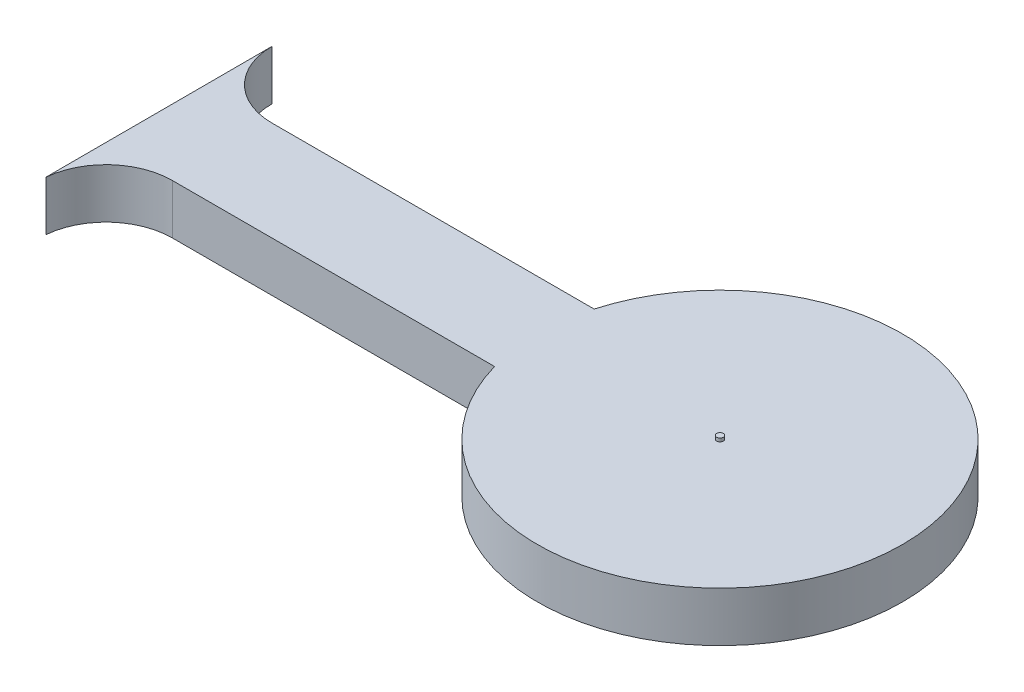
from build123d import *

# Parameters (mm, degrees)
ESBO_O2_R                = 0.1
RESSALTO_EXTRUS_O2_DEPTH = 0.1


with BuildPart() as part:
    # Ressalto-extrusão1: read off the stored shape, not the designer's step
    # Ressalto-extrusão1: loft between two sections, ruled curve by curve
    ressalto_extrus_o1_from = [
        Edge.make_three_point_arc((-1.991569883, 1.5, 1.816562273), (-1.347799048, 1.5, 0.522353991), (0, 1.5, 0)),
        Edge.make_three_point_arc((9.708497378, 1.5, -3), (15.757210532, 1.5, -6.947626291), (20.5, 1.5, -1.5)),
        Edge.make_three_point_arc((20.5, 1.5, -1.5), (15.757210532, 1.5, 3.947626291), (9.708497378, 1.5, 0)),
        Edge.make_three_point_arc((0, 1.5, -3), (-1.414213562, 1.5, -3.585786438), (-2, 1.5, -5)),
        Edge.make_line((9.708497378, 1.5, 0), (0, 1.5, 0)),
        Edge.make_line((0, 1.5, -3), (9.708497378, 1.5, -3)),
        Edge.make_line((-1.991569883, 1.5, 1.816562273), (-2, 1.5, -5)),
    ]
    ressalto_extrus_o1_to = [
        Edge.make_three_point_arc((-1.991569883, 0, 1.816562273), (-1.347799048, 0, 0.522353991), (0, 0, 0)),
        Edge.make_three_point_arc((9.708497378, 0, -3), (15.757210532, 0, -6.947626291), (20.5, 0, -1.5)),
        Edge.make_three_point_arc((20.5, 0, -1.5), (15.757210532, 0, 3.947626291), (9.708497378, 0, 0)),
        Edge.make_three_point_arc((0, 0, -3), (-1.414213562, 0, -3.585786438), (-2, 0, -5)),
        Edge.make_line((9.708497378, 0, 0), (0, 0, 0)),
        Edge.make_line((0, 0, -3), (9.708497378, 0, -3)),
        Edge.make_line((-1.991569883, 0, 1.816562273), (-2, 0, -5)),
    ]
    ressalto_extrus_o1 = Solid(Shell([*[Face.make_surface_from_curves(ressalto_extrus_o1_from[k], ressalto_extrus_o1_to[k]) for k in range(7)], Face(Wire(ressalto_extrus_o1_from)), Face(Wire(ressalto_extrus_o1_to))]))
    add(ressalto_extrus_o1)

    # Esboço2 → Ressalto-extrusão2 (add)
    with BuildSketch(Plane(origin=(0, 1.5, 0), x_dir=(1, 0, 0), z_dir=(0, 1, 0))):
        with Locations(Location((15, 1.5, 0), (0, 0, 270))):
            Circle(ESBO_O2_R)
    extrude(amount=RESSALTO_EXTRUS_O2_DEPTH)


solid = part.part
